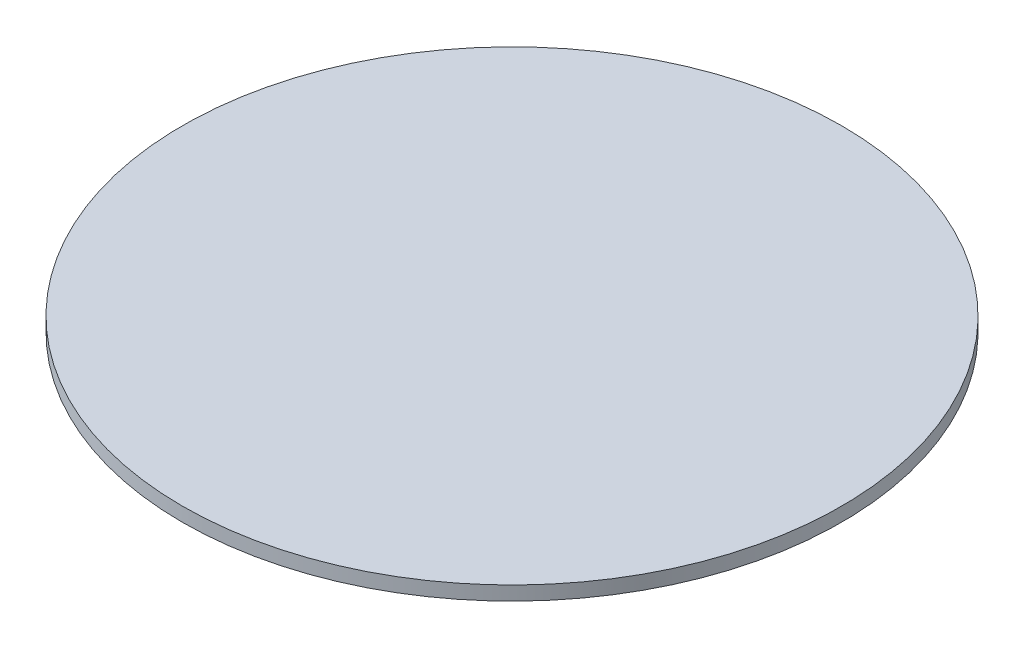
from build123d import *

# Parameters (mm, degrees)
SKETCH1_R          = 47.087793648
BASE_FLANGE1_DEPTH = 2


# Sheet-metal steps are written as plain solids
with BuildPart() as part:
    # Sketch1 → Base-Flange1 (new body)
    with BuildSketch(Plane(origin=(0, 0, 0), x_dir=(1, 0, 0), z_dir=(0, 1, 0))):
        with Locations(Location((0, 0, 0), (0, 0, 270))):
            Circle(SKETCH1_R)
    extrude(amount=-BASE_FLANGE1_DEPTH)


solid = part.part
